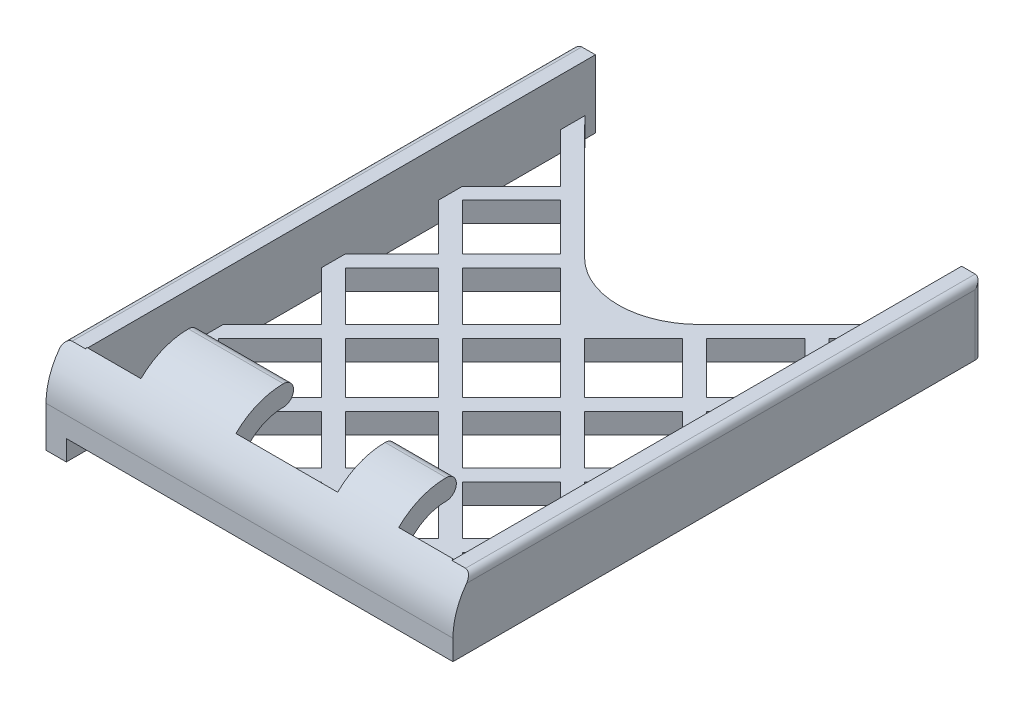
from build123d import *

# Parameters (mm, degrees)
SKETCH1_W               = 60
SKETCH1_H               = 78
SKETCH1_W_2             = 54
SKETCH1_H_2             = 72
EXTRUDE_THIN1_DEPTH     = 3
EXTRUDE_THIN2_DEPTH     = 3
BOSS_EXTRUDE1_DEPTH     = 7
SKETCH5_W               = 9
SKETCH5_H               = 3
BOSS_EXTRUDE2_DEPTH     = 10
SKETCH5_W_2             = 14
BOSS_EXTRUDE2_2_DEPTH   = 10
SKETCH6_W               = 3
SKETCH6_H               = 3
BOSS_EXTRUDE3_DEPTH     = 3
CUT_EXTRUDE1_DEPTH      = 95.731198662
SKETCH9_W               = 54
SKETCH9_H               = 3
BOSS_EXTRUDE4_DEPTH     = 3
FILLET1_R               = 7
FILLET2_R               = 10
CUT_EXTRUDE2_REACH      = 92.526
CUT_EXTRUDE3_DEPTH      = 97.922649572
CUT_EXTRUDE3_DEPTH_BACK = 97.922649572
SKETCH11_W              = 3
SKETCH11_H              = 3
FILLET3_R               = 1
CUT_EXTRUDE4_DEPTH      = 95.731198812
FILLET4_R               = 12
SKETCH14_W              = 3
SKETCH14_H              = 3
BOSS_EXTRUDE5_DEPTH     = 3


# Read off the part's stored shape, not the designer's step: Extrude-Thin2
# Some blends are built 0.0001 mm under size
with BuildPart() as part:
    # Sketch1 → Extrude-Thin1 (new body)
    with BuildSketch(Plane(origin=(0, 0, 0), x_dir=(1, 0, 0), z_dir=(0, 1, 0))):
        with Locations((27, 36)):
            Rectangle(SKETCH1_W, SKETCH1_H)
        with Locations((27, 36)):
            Rectangle(SKETCH1_W_2, SKETCH1_H_2, mode=Mode.SUBTRACT)
    extrude(amount=EXTRUDE_THIN1_DEPTH)

    # Extrude-Thin2 outline → Extrude-Thin2 (add)
    with BuildSketch(Plane(origin=(0, 0, 0), x_dir=(1, 0, 0), z_dir=(0, 1, 0))):
        Polygon((0, 69.878679656), (7.232233047, 62.646446609), (0, 55.414213562), (0, 51.878679656), (6.878679656, 45), (0, 38.121320344), (0, 34.585786438), (7.232233047, 27.353553391), (0, 20.121320344), (0, 15.878679656), (7.232233047, 8.646446609), (0, 1.414213562), (0, 0), (2.121320344, 0), (9, 6.878679656), (15.878679656, 0), (20.121320344, 0), (27.353553391, 7.232233047), (34.585786438, 0), (38.121320344, 0), (45, 6.878679656), (51.878679656, 0), (54, 0), (54, 1.414213562), (46.767766953, 8.646446609), (54, 15.878679656), (54, 19.414213562), (46.767766953, 26.646446609), (54, 33.878679656), (54, 37.414213562), (46.767766953, 44.646446609), (54, 51.878679656), (54, 55.414213562), (46.414213562, 63), (54, 70.585786438), (54, 72), (51.878679656, 72), (44.646446609, 64.767766953), (37.414213562, 72), (33.878679656, 72), (26.646446609, 64.767766953), (19.414213562, 72), (16.585786438, 72), (9, 64.414213562), (1.414213562, 72), (0, 72), align=None)
        Polygon((10.767766953, 8.646446609), (18.353553391, 16.232233047), (25.585786438, 9), (18, 1.414213562), align=None, mode=Mode.SUBTRACT)
        Polygon((9, 10.414213562), (1.414213562, 18), (9, 25.585786438), (16.585786438, 18), align=None, mode=Mode.SUBTRACT)
        Polygon((18.353553391, 19.767766953), (10.767766953, 27.353553391), (17.646446609, 34.232233047), (25.232233047, 26.646446609), align=None, mode=Mode.SUBTRACT)
        Polygon((26.646446609, 43.232233047), (34.232233047, 35.646446609), (27, 28.414213562), (19.414213562, 36), align=None, mode=Mode.SUBTRACT)
        Polygon((29.121320344, 9), (36, 15.878679656), (43.232233047, 8.646446609), (36.353553391, 1.767766953), align=None, mode=Mode.SUBTRACT)
        Polygon((20.121320344, 18), (27, 24.878679656), (34.232233047, 17.646446609), (27.353553391, 10.767766953), align=None, mode=Mode.SUBTRACT)
        Polygon((45, 24.878679656), (52.232233047, 17.646446609), (45, 10.414213562), (37.767766953, 17.646446609), align=None, mode=Mode.SUBTRACT)
        Polygon((36, 33.878679656), (43.232233047, 26.646446609), (36, 19.414213562), (28.767766953, 26.646446609), align=None, mode=Mode.SUBTRACT)
        Polygon((52.232233047, 35.646446609), (45, 28.414213562), (37.767766953, 35.646446609), (45, 42.878679656), align=None, mode=Mode.SUBTRACT)
        Polygon((15.878679656, 36), (9, 29.121320344), (1.767766953, 36.353553391), (8.646446609, 43.232233047), align=None, mode=Mode.SUBTRACT)
        Polygon((9, 60.878679656), (15.878679656, 54), (8.646446609, 46.767766953), (1.767766953, 53.646446609), align=None, mode=Mode.SUBTRACT)
        Polygon((17.646446609, 52.232233047), (24.878679656, 45), (17.646446609, 37.767766953), (10.414213562, 45), align=None, mode=Mode.SUBTRACT)
        Polygon((24.878679656, 63), (17.646446609, 55.767766953), (10.767766953, 62.646446609), (18, 69.878679656), align=None, mode=Mode.SUBTRACT)
        Polygon((33.878679656, 54), (26.646446609, 46.767766953), (19.414213562, 54), (26.646446609, 61.232233047), align=None, mode=Mode.SUBTRACT)
        Polygon((43.232233047, 44.646446609), (36, 37.414213562), (28.414213562, 45), (35.646446609, 52.232233047), align=None, mode=Mode.SUBTRACT)
        Polygon((45, 46.414213562), (37.414213562, 54), (44.646446609, 61.232233047), (52.232233047, 53.646446609), align=None, mode=Mode.SUBTRACT)
        Polygon((42.878679656, 63), (35.646446609, 55.767766953), (28.414213562, 63), (35.646446609, 70.232233047), align=None, mode=Mode.SUBTRACT)
    extrude(amount=EXTRUDE_THIN2_DEPTH)

    # Sketch4 → Boss-Extrude1 (add)
    with BuildSketch(Plane(origin=(0, 3, 0), x_dir=(1, 0, 0), z_dir=(0, 1, 0))):
        Polygon((0, 0), (0, 72), (0, 75), (-3, 75), (-3, -3), (57, -3), (57, 75), (54, 75), (54, 72), (54, 0), align=None)
    extrude(amount=BOSS_EXTRUDE1_DEPTH)

    # Sketch6 → Boss-Extrude3 (add)
    with BuildSketch(Plane.XZ):
        with Locations((-1.5, 1.5)):
            Rectangle(SKETCH6_W, SKETCH6_H)
    extrude(amount=BOSS_EXTRUDE3_DEPTH)

    # Sketch7 → Cut-Extrude1 (cut, through all)
    with BuildSketch(Plane(origin=(0, 3, 0), x_dir=(1, 0, 0), z_dir=(0, 1, 0))):
        Polygon((33.878679656, 72), (36.878679656, 75), (16.414213562, 75), (0, 75), (0, 73.5), (1.414213562, 72), (17.646446609, 55.767766953), (26.646446609, 64.767766953), align=None)
    extrude(amount=-CUT_EXTRUDE1_DEPTH, mode=Mode.SUBTRACT)



with BuildPart() as body_2:
    # Sketch5 → Boss-Extrude2 (new body)
    with BuildSketch(Plane(origin=(0, 0, 0), x_dir=(-1, 0, 0), z_dir=(0, 0, -1))):
        with Locations((-41.5, 11.5)):
            Rectangle(SKETCH5_W, SKETCH5_H)
    extrude(amount=BOSS_EXTRUDE2_DEPTH)


with BuildPart() as body_3:
    # Sketch5 → Boss-Extrude2 2 (new body)
    with BuildSketch(Plane(origin=(0, 0, 0), x_dir=(-1, 0, 0), z_dir=(0, 0, -1))):
        with Locations((-15, 11.5)):
            Rectangle(SKETCH5_W_2, SKETCH5_H)
    extrude(amount=BOSS_EXTRUDE2_2_DEPTH)


with BuildPart() as part_1:
    add(part.part)

    add(body_2.part)  # Boss-Extrude4 merges body 2

    add(body_3.part)  # Boss-Extrude4 merges body 3
    # Sketch9 → Boss-Extrude4 (add)
    with BuildSketch(Plane.XY):
        with Locations((27, 11.5)):
            Rectangle(SKETCH9_W, SKETCH9_H)
    extrude(amount=BOSS_EXTRUDE4_DEPTH)

    # Fillet1
    fillet1_edges = [part_1.edges().sort_by_distance(p)[0] for p in [
        (41.5, 10, 0),
        (15, 10, 0),
    ]]
    fillet(fillet1_edges, radius=FILLET1_R - 0.0001)  # a hair under: the kernel refuses the full size

    # Fillet2
    # the kernel refuses this fillet: 10 mm, written as the material it takes off along each edge
    with BuildSketch(Plane(origin=(79, 13, 3), x_dir=(0, -1, 0), z_dir=(-1, 0, 0))) as fillet2_piece_1:
        with BuildLine():
            CenterArc((FILLET2_R, -FILLET2_R), FILLET2_R, 90, 90)
            Line((0, -FILLET2_R), (0, 0))
            Line((0, 0), (FILLET2_R, 0))
        make_face()
    extrude(amount=104, mode=Mode.SUBTRACT)

    # Sketch10 → Cut-Extrude2 (cut, up to next)
    with BuildSketch(Plane.ZY.offset(-8), mode=Mode.PRIVATE) as cut_extrude2_sk1:
        with BuildLine():
            ThreePointArc((-7, 10), (-8.5, 11.5), (-7, 13))
            Line((-7, 13), (-10, 13))
            Line((-10, 13), (-10, 10))
            Line((-10, 10), (-7, 10))
        make_face()
    cut_extrude2_tool1 = extrude(cut_extrude2_sk1.sketch, amount=-CUT_EXTRUDE2_REACH, mode=Mode.PRIVATE) & part_1.part
    add(cut_extrude2_tool1.solids().sort_by_distance((8, 11.5, -9.058288))[0], mode=Mode.SUBTRACT)
    add(cut_extrude2_tool1.solids().sort_by_distance((8, 11.5, -9.058288))[1], mode=Mode.SUBTRACT)

    # Sketch11 → Cut-Extrude3 (cut, two sides: drawn at the far end of the back side and taken through both)
    with BuildSketch(Plane.ZY.offset(3).offset(-CUT_EXTRUDE3_DEPTH_BACK)):
        with Locations((1.5, -1.5)):
            Rectangle(SKETCH11_W, SKETCH11_H)
    extrude(amount=CUT_EXTRUDE3_DEPTH + CUT_EXTRUDE3_DEPTH_BACK, mode=Mode.SUBTRACT)

    # Fillet3
    fillet3_edges = [part_1.edges().sort_by_distance(p)[0] for p in [
        (57, 10, -37.429285786),
        (-3, 10, -37.429285786),
        (-3, 5, -75),
        (57, 5, -75),
    ]]
    fillet(fillet3_edges, radius=FILLET3_R)

    # Sketch12 → Cut-Extrude4 (cut, through all)
    with BuildSketch(Plane(origin=(0, 3, 0), x_dir=(1, 0, 0), z_dir=(0, 1, 0))):
        Polygon((17.646446609, 55.767766953), (26.646446609, 46.767766953), (54, 74.121320344), (54, 75), (17.646446609, 75), align=None)
    extrude(amount=-CUT_EXTRUDE4_DEPTH, mode=Mode.SUBTRACT)

    # Fillet4
    fillet4_edges = [part_1.edges().sort_by_distance(p)[0] for p in [
        (26.646446609, 1.5, -46.767766953),
    ]]
    fillet(fillet4_edges, radius=FILLET4_R)

    # Sketch14 → Boss-Extrude5 (add)
    with BuildSketch(Plane.XZ):
        with Locations((-1.5, 1.5)):
            Rectangle(SKETCH14_W, SKETCH14_H)
    extrude(amount=BOSS_EXTRUDE5_DEPTH)


solid = part_1.part
